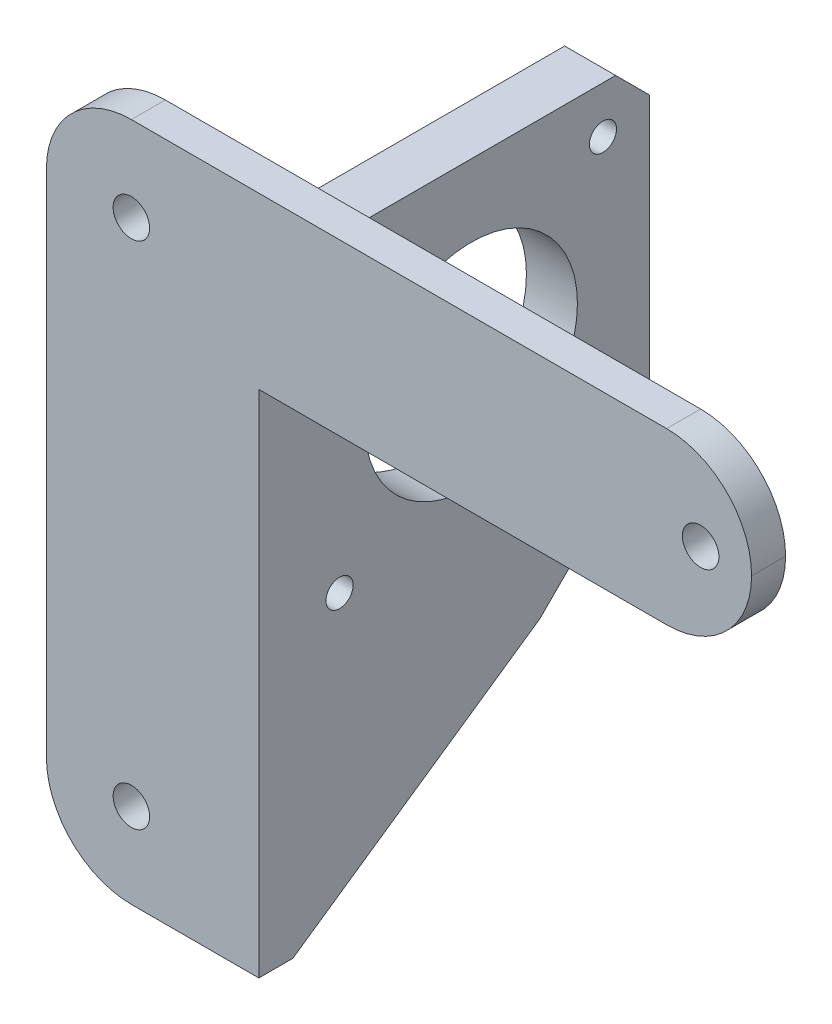
from build123d import *
from OCP.BRepFilletAPI import BRepFilletAPI_MakeChamfer

# Parameters (mm, degrees)
BOSS_EXTRU_1_DEPTH   = 4
ESQUISSE3_R          = 12.5
BOSS_EXTRU_2_DEPTH   = 6
D_GAGEMENT_M31_D     = 3.2
D_GAGEMENT_M41_D     = 4.3
D_GAGEMENT_M41_DEPTH = 15
CONG_1_R             = 2
CHANFREIN1_SIZE      = 4
CHANFREIN1_SIZE2     = 15.704369422
CONG_2_R             = 10


with BuildPart() as part:
    # Esquisse1 → Boss.-Extru.1 (new body)
    with BuildSketch(Plane.XY):
        Polygon((0, 0), (0, -80), (25, -80), (25, -20), (83, -20), (83, 0), align=None)
    extrude(amount=BOSS_EXTRU_1_DEPTH)

    # Esquisse3 → Boss.-Extru.2 (add)
    with BuildSketch(Plane(origin=(25, 0, 0), x_dir=(0, 0, -1), z_dir=(1, 0, 0))):
        Polygon((0, -9), (42, -9), (42, -51), (0, -80), align=None)
        with Locations((21, -30)):
            Circle(ESQUISSE3_R, mode=Mode.SUBTRACT)
    extrude(amount=-BOSS_EXTRU_2_DEPTH)

    # Dégagement M31 (through all)
    with Locations(Plane(origin=(25, 0, 0), x_dir=(0, 0, -1), z_dir=(1, 0, 0))):
        with Locations((5.5, -14.5), (36.5, -14.5), (36.5, -45.5), (5.5, -45.5)):
            Hole(D_GAGEMENT_M31_D / 2)

    # Dégagement M41
    with Locations(Plane.XY.offset(4)):
        with Locations((10, -10), (10, -70), (77, -10)):
            Hole(D_GAGEMENT_M41_D / 2, depth=D_GAGEMENT_M41_DEPTH)

    # Congé1
    cong_1_edges = [part.edges().sort_by_distance(p)[0] for p in [
        (19, -44.5, 0),
        (22, -9, 0),
    ]]
    fillet(cong_1_edges, radius=CONG_1_R)

    # Chanfrein1: one chamfer whose edges measure the first distance from different faces: ONE call of the kernel's chamfer builder (chamfer() names one face for all edges)
    chanfrein1_edges_1 = [part.edges().sort_by_distance(p)[0] for p in [
        (22, -9, -42),
    ]]
    chanfrein1_edges_2 = [part.edges().sort_by_distance(p)[0] for p in [
        (22, -51, -42),
    ]]
    chanfrein1_side_2 = [part.faces().sort_by_distance(p)[0] for p in [
        (22, -30, -42),
    ]]
    chanfrein1 = BRepFilletAPI_MakeChamfer(part.part.solid().wrapped)
    for e in chanfrein1_edges_1:
        chanfrein1.Add(CHANFREIN1_SIZE, e.wrapped)
    for e in chanfrein1_edges_2:
        chanfrein1.Add(CHANFREIN1_SIZE, CHANFREIN1_SIZE2, e.wrapped, chanfrein1_side_2[0].wrapped)  # the first distance lies on this face
    add(Compound.cast(chanfrein1.Shape()), mode=Mode.REPLACE)

    # Congé2
    cong_2_edges = [part.edges().sort_by_distance(p)[0] for p in [
        (83, -20, 2),
        (0, -80, 2),
        (0, 0, 2),
        (83, 0, 2),
    ]]
    fillet(cong_2_edges, radius=CONG_2_R - 0.0001)  # a hair under: the kernel refuses the full size


solid = part.part
